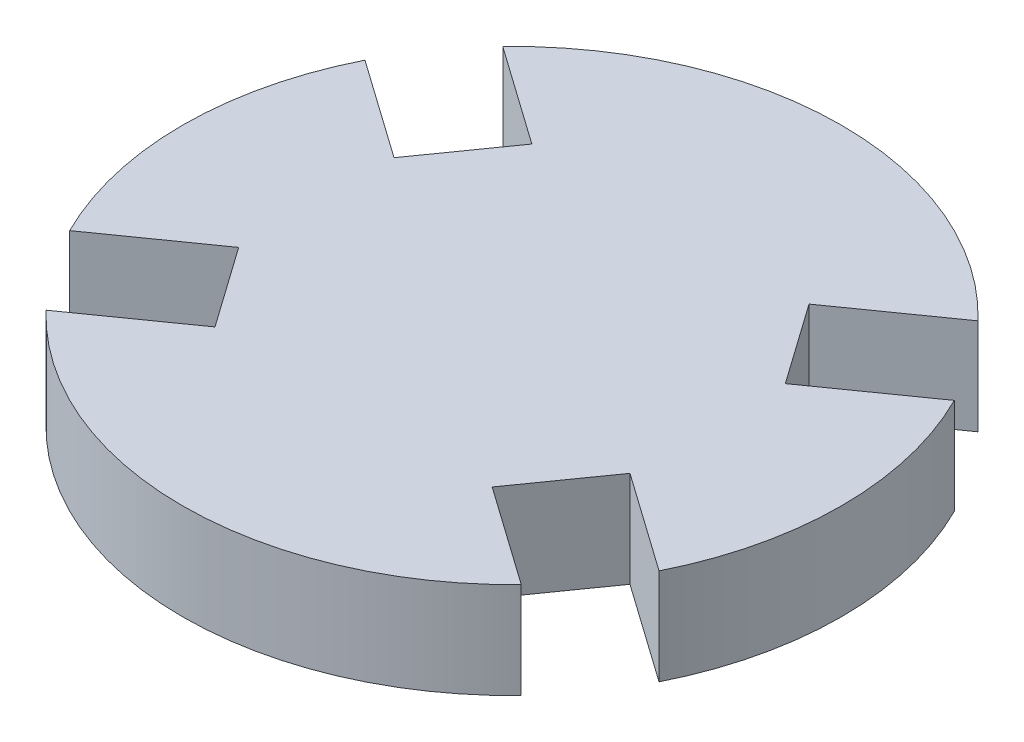
from build123d import *

# Parameters (mm, degrees)
CROQUIS1_R              = 12
SALIENTE_EXTRUIR1_DEPTH = 3.5
CORTAR_EXTRUIR1_DEPTH   = 3.5


with BuildPart() as part:
    # Croquis1 → Saliente-Extruir1 (new body)
    with BuildSketch(Plane(origin=(0, 0, 0), x_dir=(1, 0, 0), z_dir=(0, 1, 0))):
        Circle(CROQUIS1_R)
    extrude(amount=SALIENTE_EXTRUIR1_DEPTH)

    # Croquis3 → Cortar-Extruir1 (cut)
    with BuildSketch(Plane(origin=(0, 3.5, 0), x_dir=(1, 0, 0), z_dir=(0, 1, 0))):
        Polygon((14.556125886, 8.078471339), (7.12348752, 2.828148787), (5.046436839, 5.768533195), (12.479075206, 11.018855748), align=None)
        Polygon((-5.046436839, -5.768533195), (-7.12348752, -2.828148787), (-14.556125886, -8.078471339), (-12.479075206, -11.018855748), align=None)
        Polygon((12.479075206, -11.018855748), (5.046436839, -5.768533195), (7.12348752, -2.828148787), (14.556125886, -8.078471339), align=None)
        Polygon((-7.12348752, 2.828148787), (-5.046436839, 5.768533195), (-12.479075206, 11.018855748), (-14.556125886, 8.078471339), align=None)
    extrude(amount=-CORTAR_EXTRUIR1_DEPTH, mode=Mode.SUBTRACT)


solid = part.part
